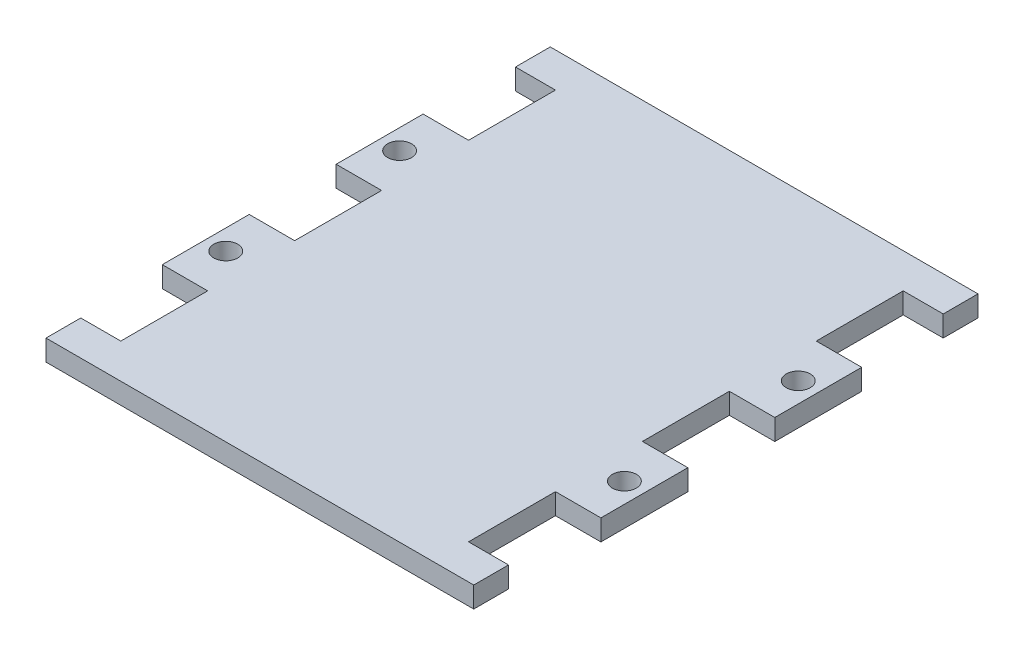
from build123d import *

# Parameters (mm, degrees)
SKETCH1_R           = 1.7526
BOSS_EXTRUDE1_DEPTH = 3.048


with BuildPart() as part:
    # Sketch1 → Boss-Extrude1 (new body)
    with BuildSketch(Plane(origin=(0, 0, 0), x_dir=(1, 0, 0), z_dir=(0, 1, 0))):
        Polygon((31.242, -36.83), (-31.242, -36.83), (-31.242, -31.75), (-25.4, -31.75), (-25.4, -19.05), (-31.242, -19.05), (-32.03575, -19.05), (-32.03575, -6.35), (-31.242, -6.35), (-25.4, -6.35), (-25.4, 6.35), (-31.242, 6.35), (-32.03575, 6.35), (-32.03575, 19.05), (-31.242, 19.05), (-25.4, 19.05), (-25.4, 31.75), (-31.242, 31.75), (-31.242, 36.83), (31.242, 36.83), (31.242, 31.75), (25.4, 31.75), (25.4, 19.05), (31.242, 19.05), (32.03575, 19.05), (32.03575, 6.35), (31.242, 6.35), (25.4, 6.35), (25.4, -6.35), (31.242, -6.35), (32.03575, -6.35), (32.03575, -19.05), (31.242, -19.05), (25.4, -19.05), (25.4, -31.75), (31.242, -31.75), align=None)
        with Locations((-29.11475, 12.7)):
            Circle(SKETCH1_R, mode=Mode.SUBTRACT)
        with Locations((-29.11475, -12.7)):
            Circle(SKETCH1_R, mode=Mode.SUBTRACT)
        with Locations((29.11475, -12.7)):
            Circle(SKETCH1_R, mode=Mode.SUBTRACT)
        with Locations((29.11475, 12.7)):
            Circle(SKETCH1_R, mode=Mode.SUBTRACT)
    extrude(amount=BOSS_EXTRUDE1_DEPTH)


solid = part.part
